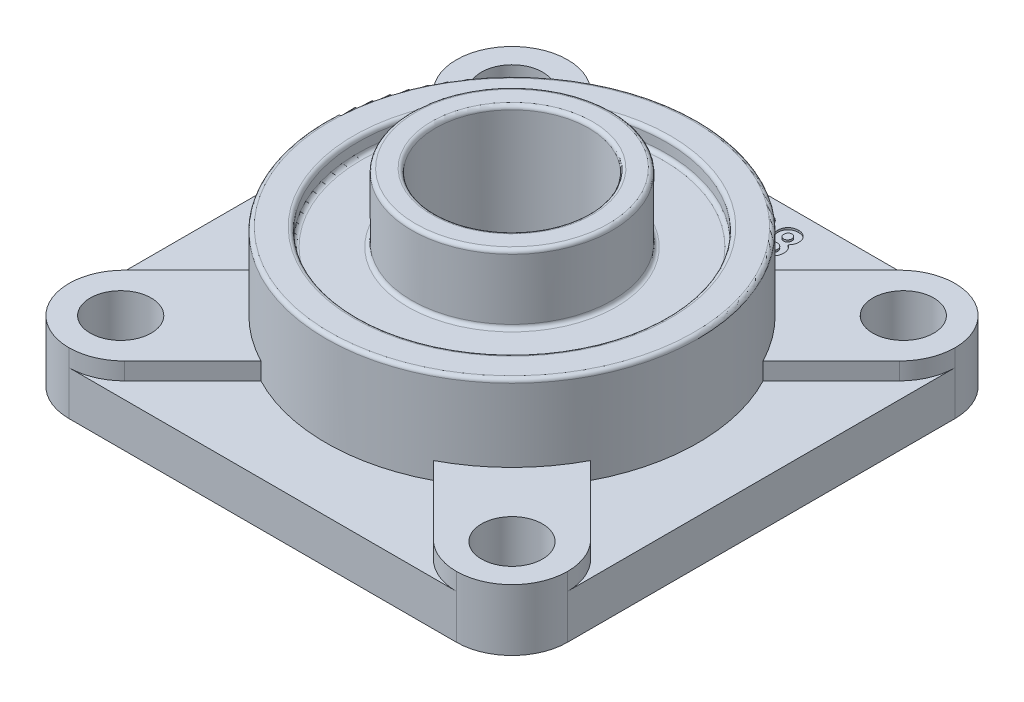
from build123d import *

# Parameters (mm, degrees)
ESBO_O1_W                = 130
ESBO_O1_H                = 130
RESSALTO_EXTRUS_O1_DEPTH = 11.5
RESSALTO_EXTRUS_O2_DEPTH = 4.5
ESBO_O3_R                = 48.5
RESSALTO_EXTRUS_O3_DEPTH = 36
ESBO_O5_R                = 26.15
RESSALTO_EXTRUS_O4_DEPTH = 49.3
CORTE_EXTRUS_O1_START    = -4.5
ESBO_O6_R                = 40.25
ESBO_O6_R_2              = 26.15
CORTE_EXTRUS_O1_DEPTH    = 4.5
ESBO_O7_R                = 20
CORTE_EXTRUS_O2_DEPTH    = 105.309587287
CORTE_EXTRUS_O3_DEPTH    = 98.769576045
FILETE4_R                = 14.5
FILETE5_R                = 1
CORTE_EXTRUS_O4_DEPTH    = 0.5
FILETE6_R                = 1


with BuildPart() as part:
    # Esboço1 → Ressalto-extrusão1 (new body)
    with BuildSketch(Plane(origin=(0, 0, 0), x_dir=(1, 0, 0), z_dir=(0, 1, 0))):
        Rectangle(ESBO_O1_W, ESBO_O1_H)
    extrude(amount=RESSALTO_EXTRUS_O1_DEPTH)

    # Esboço2 → Ressalto-extrusão2 (add)
    with BuildSketch(Plane(origin=(0, 11.5, 0), x_dir=(1, 0, 0), z_dir=(0, 1, 0))):
        Polygon((-10.253048327, 10.253048327), (-65, 65), (-65, 44.493903346), (-20.506096654, 0), align=None)
        Polygon((-44.493903346, 65), (-65, 65), (-10.253048327, 10.253048327), (0, 20.506096654), align=None)
        Polygon((44.493903346, 65), (0, 20.506096654), (10.253048327, 10.253048327), (65, 65), align=None)
        Polygon((65, 65), (10.253048327, 10.253048327), (20.506096654, 0), (65, 44.493903346), align=None)
        Polygon((0, 0), (-10.253048327, 10.253048327), (-20.506096654, 0), (-10.253048327, -10.253048327), align=None)
        Polygon((0, 20.506096654), (-10.253048327, 10.253048327), (0, 0), (10.253048327, 10.253048327), align=None)
        Polygon((10.253048327, 10.253048327), (0, 0), (10.253048327, -10.253048327), (20.506096654, 0), align=None)
        Polygon((10.253048327, -10.253048327), (0, 0), (-10.253048327, -10.253048327), (0, -20.506096654), align=None)
        Polygon((-10.253048327, -10.253048327), (-20.506096654, 0), (-65, -44.493903346), (-65, -65), align=None)
        Polygon((0, -20.506096654), (-10.253048327, -10.253048327), (-65, -65), (-44.493903346, -65), align=None)
        Polygon((65, -65), (10.253048327, -10.253048327), (0, -20.506096654), (44.493903346, -65), align=None)
        Polygon((20.506096654, 0), (10.253048327, -10.253048327), (65, -65), (65, -44.493903346), align=None)
    extrude(amount=RESSALTO_EXTRUS_O2_DEPTH)

    # Esboço3 → Ressalto-extrusão3 (add)
    with BuildSketch(Plane.XZ):
        with Locations(Location((0, 0, 0), (0, 0, 270))):
            Circle(ESBO_O3_R)
    extrude(amount=-RESSALTO_EXTRUS_O3_DEPTH)

    # Esboço5 → Ressalto-extrusão4 (add)
    with BuildSketch(Plane.XZ):
        with Locations(Location((0, 0, 0), (0, 0, 270))):
            Circle(ESBO_O5_R)
    extrude(amount=-RESSALTO_EXTRUS_O4_DEPTH)

    # Esboço6 → Corte-extrusão1 (cut)
    with BuildSketch(Plane(origin=(0, 36, 0), x_dir=(1, 0, 0), z_dir=(0, 1, 0)).offset(CORTE_EXTRUS_O1_START)):
        with Locations(Location((0, 0, 0), (0, 0, 270))):
            Circle(ESBO_O6_R)
        with Locations(Location((0, 0, 0), (0, 0, 90))):
            Circle(ESBO_O6_R_2, mode=Mode.SUBTRACT)
    extrude(amount=CORTE_EXTRUS_O1_DEPTH, mode=Mode.SUBTRACT)

    # Esboço7 → Corte-extrusão2 (cut, through all)
    with BuildSketch(Plane(origin=(0, 49.3, 0), x_dir=(1, 0, 0), z_dir=(0, 1, 0))):
        with Locations(Location((0, 0, 0), (0, 0, 270))):
            Circle(ESBO_O7_R)
    extrude(amount=-CORTE_EXTRUS_O2_DEPTH, mode=Mode.SUBTRACT)

    # Esboço8 → Corte-extrusão3 (cut, through all)
    with BuildSketch(Plane(origin=(0, 16, 0), x_dir=(1, 0, 0), z_dir=(0, 1, 0))):
        with BuildLine():
            ThreePointArc((-51, -43.05), (-56.62149891, -56.62149891), (-43.05, -51))
            Line((-43.05, -51), (-51, -51))
            Line((-51, -51), (-51, -43.05))
        make_face()
        with BuildLine():
            Line((-51, -51), (-43.05, -51))
            ThreePointArc((-43.05, -51), (-45.37850109, -45.37850109), (-51, -43.05))
            Line((-51, -43.05), (-51, -51))
        make_face()
        with BuildLine():
            ThreePointArc((-43.05, 51), (-56.62149891, 56.62149891), (-51, 43.05))
            Line((-51, 43.05), (-51, 51))
            Line((-51, 51), (-43.05, 51))
        make_face()
        with BuildLine():
            Line((-51, 51), (-51, 43.05))
            ThreePointArc((-51, 43.05), (-45.37850109, 45.37850109), (-43.05, 51))
            Line((-43.05, 51), (-51, 51))
        make_face()
        with BuildLine():
            ThreePointArc((43.05, 51), (45.37850109, 45.37850109), (51, 43.05))
            Line((51, 43.05), (51, 51))
            Line((51, 51), (43.05, 51))
        make_face()
        with BuildLine():
            Line((51, 51), (51, 43.05))
            ThreePointArc((51, 43.05), (56.62149891, 45.37850109), (58.95, 51))
            ThreePointArc((58.95, 51), (51, 58.95), (43.05, 51))
            Line((43.05, 51), (51, 51))
        make_face()
        with BuildLine():
            ThreePointArc((51, -43.05), (45.37850109, -45.37850109), (43.05, -51))
            Line((43.05, -51), (51, -51))
            Line((51, -51), (51, -43.05))
        make_face()
        with BuildLine():
            Line((51, -51), (43.05, -51))
            ThreePointArc((43.05, -51), (51, -58.95), (58.95, -51))
            ThreePointArc((58.95, -51), (56.62149891, -45.37850109), (51, -43.05))
            Line((51, -43.05), (51, -51))
        make_face()
    extrude(amount=-CORTE_EXTRUS_O3_DEPTH, mode=Mode.SUBTRACT)

    # Filete4
    # the kernel refuses this fillet: 14.5 mm, written as the material it adds along each edge
    # the kernel refuses this fillet: 14.5 mm, written as the material it takes off along each edge
    with BuildSketch(Plane(origin=(-65, 11.5, -44.493903346), x_dir=(0, 0, -1), z_dir=(0, 1, 0)), Plane(origin=(65, 11.5, 44.493903346), x_dir=(0, 0, 1), z_dir=(0, 1, 0)), Plane(origin=(44.493903346, 11.5, -65), x_dir=(1, 0, 0), z_dir=(0, 1, 0)), Plane(origin=(-44.493903346, 11.5, 65), x_dir=(-1, 0, 0), z_dir=(0, 1, 0))) as filete4_2_piece_1:
        with BuildLine():
            CenterArc((FILETE4_R * 0.414213562373, -FILETE4_R), FILETE4_R, 90, 45)
            Line((-FILETE4_R * 0.292893218813, -FILETE4_R * 0.292893218813), (0, 0))
            Line((0, 0), (FILETE4_R * 0.414213562373, 0))
        make_face()
    extrude(amount=19.515241636, mode=Mode.SUBTRACT)
    with BuildSketch(Plane(origin=(44.493903346, 11.5, 65), x_dir=(1, 0, 0), z_dir=(0, 1, 0)), Plane(origin=(-44.493903346, 11.5, -65), x_dir=(-1, 0, 0), z_dir=(0, 1, 0)), Plane(origin=(-65, 11.5, 44.493903346), x_dir=(0, 0, 1), z_dir=(0, 1, 0)), Plane(origin=(65, 11.5, -44.493903346), x_dir=(0, 0, -1), z_dir=(0, 1, 0))) as filete4_2_piece_2:
        with BuildLine():
            CenterArc((FILETE4_R * 0.414213562373, FILETE4_R), FILETE4_R, 225, 45)
            Line((-FILETE4_R * 0.292893218813, FILETE4_R * 0.292893218813), (0, 0))
            Line((0, 0), (FILETE4_R * 0.414213562373, 0))
        make_face()
    extrude(amount=19.515241636, mode=Mode.SUBTRACT)
    with BuildSketch(Plane(origin=(-65, -36.25, -65), x_dir=(1, 0, 0), z_dir=(0, 1, 0)), Plane(origin=(-65, -36.25, 65), x_dir=(0, 0, -1), z_dir=(0, 1, 0)), Plane(origin=(65, 52.25, 65), x_dir=(0, 0, -1), z_dir=(0, -1, 0)), Plane(origin=(65, 52.25, -65), x_dir=(-1, 0, 0), z_dir=(0, -1, 0))) as filete4_2_piece_3:
        with BuildLine():
            CenterArc((FILETE4_R, -FILETE4_R), FILETE4_R, 90, 90)
            Line((0, -FILETE4_R), (0, 0))
            Line((0, 0), (FILETE4_R, 0))
        make_face()
    extrude(amount=88.5, mode=Mode.SUBTRACT)

    # Filete5
    filete5_edges = [part.edges().sort_by_distance(p)[0] for p in [
        (0, 49.3, 26.15),
        (0, 36, -40.25),
        (0, 49.3, -20),
        (0, 36, 48.5),
    ]]
    fillet(filete5_edges, radius=FILETE5_R)

    # Esboço9 → Corte-extrusão4 (cut)
    # profile 1 of 4: a face of its own
    with BuildSketch(Plane(origin=(0, 11.5, 0), x_dir=(1, 0, 0), z_dir=(0, 1, 0))):
        Polygon((-13.5673169, 60.857243767), (-8.926932285, 60.857243767), (-8.926932285, 59.147628382), (-11.857701516, 59.147628382), (-11.857701516, 57.315897613), (-8.926932285, 57.315897613), (-8.926932285, 55.606282228), (-11.857701516, 55.606282228), (-11.857701516, 51.332243767), (-13.5673169, 51.332243767), align=None)
    # profile 2 of 4: a face of its own
    with BuildSketch(Plane(origin=(0, 11.5, 0), x_dir=(1, 0, 0), z_dir=(0, 1, 0))):
        with BuildLine():
            Line((-2.4548169, 57.682243767), (-4.164432285, 57.682243767))
            add(Edge.make_bspline(
                [(-4.164432285, 57.682243767), (-4.157048718, 57.811567126), (-4.142621672, 58.064257205), (-4.08523453, 58.431297637), (-4.008337729, 58.778110483), (-3.90570874, 59.103482555), (-3.776748699, 59.407295624), (-3.624776082, 59.690585403), (-3.445908333, 59.951860367), (-3.243952346, 60.1898605), (-3.022336778, 60.403372615), (-2.785662586, 60.59268587), (-2.530309519, 60.748902404), (-2.260943087, 60.877454148), (-1.977609157, 60.980161018), (-1.677626945, 61.048828872), (-1.36359386, 61.095331416), (-1.148612783, 61.099400575), (-1.03904166, 61.101474536)],
                knots=[0, 0, 0, 0, 1.199038563, 2.342849363, 3.436047546, 4.486744587, 5.497670872, 6.488682221, 7.459191391, 8.424610317, 9.374430501, 10.305433194, 11.225809216, 12.140057399, 13.06607119, 14.010487599, 14.985989317, 16, 16, 16, 16], degree=3))
            add(Edge.make_bspline(
                [(-1.03904166, 61.101474536), (-0.904544661, 61.097277875), (-0.641974999, 61.089085009), (-0.260440454, 61.019197146), (0.095871095, 60.902298896), (0.426700644, 60.738961211), (0.729231782, 60.531457804), (1.003414341, 60.284043952), (1.240956603, 59.991528782), (1.443364657, 59.666083373), (1.611541559, 59.321482487), (1.729392927, 58.965150882), (1.806855362, 58.606544152), (1.81511721, 58.365076531), (1.819221561, 58.245119368)],
                knots=[0, 0, 0, 0, 1.075374347, 2.099382735, 3.09057751, 4.06680945, 5.040638231, 6.016817125, 7.011024321, 8.044445721, 9.0776792, 10.070479129, 11.0414456, 12, 12, 12, 12], degree=3))
            add(Edge.make_bspline(
                [(1.819221561, 58.245119368), (1.817623544, 58.172560797), (1.814407129, 58.026518317), (1.792042971, 57.805520201), (1.758492315, 57.580407783), (1.707906103, 57.351374074), (1.644820948, 57.118354873), (1.568289538, 56.880652833), (1.47653665, 56.639615639), (1.371093454, 56.392530458), (1.245299454, 56.138595101), (1.098829826, 55.874002977), (0.927796934, 55.598988802), (0.734266641, 55.311999755), (0.517299016, 55.013488463), (0.275834894, 54.704354135), (0.012655376, 54.38350748), (-0.174130532, 54.169039496), (-0.270096347, 54.058851339)],
                knots=[0, 0, 0, 0, 0.728284026, 1.46585585, 2.227944881, 3.01186502, 3.81876927, 4.650621989, 5.517437689, 6.406905708, 7.346299482, 8.360816762, 9.441613733, 10.596154504, 11.834900912, 13.145207542, 14.533280747, 16, 16, 16, 16], degree=3))
            Line((-0.270096347, 54.058851339), (-1.2641919, 52.919743767))
            Line((-1.2641919, 52.919743767), (1.941336946, 52.919743767))
            Line((1.941336946, 52.919743767), (1.941336946, 51.332243767))
            Line((1.941336946, 51.332243767), (-4.408663054, 51.332243767))
            Line((-4.408663054, 51.332243767), (-4.408663054, 52.198499776))
            Line((-4.408663054, 52.198499776), (-1.588560891, 55.199866964))
            add(Edge.make_bspline(
                [(-1.588560891, 55.199866964), (-1.506911686, 55.287417777), (-1.34878139, 55.456977738), (-1.123778275, 55.705994579), (-0.920170332, 55.942305618), (-0.742179536, 56.16842709), (-0.580465161, 56.377024534), (-0.442238037, 56.574385338), (-0.326233494, 56.758725289), (-0.20029411, 56.981007076), (-0.080693094, 57.246117662), (0.029048077, 57.551535926), (0.095942915, 57.843445448), (0.105176518, 58.033659967), (0.109606177, 58.124912036)],
                knots=[0, 0, 0, 0, 1.246127091, 2.413378631, 3.493388633, 4.492180848, 5.408488754, 6.240484944, 6.999099869, 7.674939598, 8.898438119, 10.020720584, 11.050475521, 12, 12, 12, 12], degree=3))
            add(Edge.make_bspline(
                [(0.109606177, 58.124912036), (0.106294228, 58.213191373), (0.099876796, 58.384246741), (0.029354422, 58.627572093), (-0.079901286, 58.847878359), (-0.233858009, 59.038582541), (-0.420347819, 59.195296813), (-0.635854312, 59.311856485), (-0.878620477, 59.379110882), (-1.048804183, 59.38752873), (-1.136352357, 59.391859151)],
                knots=[0, 0, 0, 0, 1.062038974, 2.057870785, 3.028805853, 4.01125022, 4.991535629, 5.949134679, 6.94496649, 8, 8, 8, 8], degree=3))
            add(Edge.make_bspline(
                [(-1.136352357, 59.391859151), (-1.181580859, 59.390259442), (-1.270620428, 59.387110156), (-1.401501635, 59.366146216), (-1.526044506, 59.32919946), (-1.645635274, 59.279696008), (-1.758997633, 59.214078826), (-1.865845649, 59.133195195), (-1.967305099, 59.039100552), (-2.062910651, 58.932089118), (-2.149924184, 58.812664327), (-2.227209286, 58.681916879), (-2.291111199, 58.539927934), (-2.347372766, 58.388571962), (-2.390764378, 58.226223276), (-2.422358855, 58.053853516), (-2.446378026, 57.871743105), (-2.451952769, 57.746559322), (-2.4548169, 57.682243767)],
                knots=[0, 0, 0, 0, 0.903469896, 1.778625579, 2.63899355, 3.493148037, 4.358286772, 5.247621495, 6.164656832, 7.118446693, 8.109501108, 9.111810964, 10.146451449, 11.215617525, 12.33435995, 13.498009769, 14.714554818, 16, 16, 16, 16], degree=3))
        make_face()
    # profile 3 of 4: a face of its own
    with BuildSketch(Plane(origin=(0, 11.5, 0), x_dir=(1, 0, 0), z_dir=(0, 1, 0))):
        with BuildLine():
            add(Edge.make_bspline(
                [(6.247812306, 61.101474536), (6.330564787, 61.100246052), (6.493278273, 61.097830524), (6.73292461, 61.071668393), (6.96377029, 61.03214471), (7.186718411, 60.977022953), (7.40016417, 60.904071272), (7.605661068, 60.81674936), (7.800763098, 60.710477003), (7.987958434, 60.590436918), (8.167174969, 60.454534524), (8.334105358, 60.299598778), (8.491798105, 60.129194758), (8.636839742, 59.940746261), (8.772442262, 59.735967426), (8.898160096, 59.51482578), (9.013030844, 59.276238985), (9.118341933, 59.01977649), (9.212511441, 58.741594035), (9.291830301, 58.438500745), (9.359859496, 58.110427405), (9.417280936, 57.756557389), (9.460682264, 57.37642032), (9.489935633, 56.970268742), (9.51001068, 56.538885656), (9.511649065, 56.242960404), (9.512490792, 56.090927661)],
                knots=[0, 0, 0, 0, 0.879237366, 1.728815576, 2.559023295, 3.367336655, 4.166867292, 4.954216142, 5.737608147, 6.525189134, 7.316157332, 8.124696809, 8.942788509, 9.781158001, 10.649253743, 11.551476218, 12.482711956, 13.461909668, 14.496590415, 15.601789533, 16.789733467, 18.056700938, 19.410929216, 20.8549011, 22.384193279, 24, 24, 24, 24], degree=3))
            add(Edge.make_bspline(
                [(9.512490792, 56.090927661), (9.511581113, 55.936992818), (9.509813622, 55.637900178), (9.490770159, 55.202571443), (9.457976415, 54.793470961), (9.415709472, 54.410641057), (9.357815321, 54.054283896), (9.290013222, 53.723476753), (9.209442338, 53.418339537), (9.112170916, 53.139559788), (9.007497278, 52.882646889), (8.892312309, 52.644525281), (8.768623667, 52.424549999), (8.639268398, 52.219402416), (8.497154768, 52.035130178), (8.349199849, 51.865467067), (8.188961421, 51.716875767), (8.023186139, 51.58169855), (7.845800985, 51.464878308), (7.658635286, 51.36270925), (7.458352201, 51.279838009), (7.248602552, 51.20776103), (7.025811113, 51.156017536), (6.793518008, 51.114960774), (6.549100696, 51.092270289), (6.382691546, 51.089455385), (6.297421681, 51.088012997)],
                knots=[0, 0, 0, 0, 1.643780988, 3.193836972, 4.651895693, 6.025988579, 7.305620092, 8.505800249, 9.631074763, 10.672816429, 11.65661981, 12.592235626, 13.49536222, 14.350718032, 15.179365177, 15.97804903, 16.751647189, 17.51006938, 18.259804725, 19.016521909, 19.783502495, 20.571750527, 21.382245291, 22.22305063, 23.089471752, 24, 24, 24, 24], degree=3))
            add(Edge.make_bspline(
                [(6.297421681, 51.088012997), (6.212154118, 51.089483208), (6.045116216, 51.092363328), (5.800037976, 51.11479206), (5.566513835, 51.156183857), (5.341959757, 51.208158278), (5.127938603, 51.279678531), (4.923424149, 51.36502922), (4.729988933, 51.466560794), (4.547097364, 51.583653217), (4.375373886, 51.717925996), (4.212149917, 51.867942933), (4.057786518, 52.033323774), (3.914631939, 52.21592092), (3.780341721, 52.413297082), (3.656316301, 52.627706198), (3.542630213, 52.858836095), (3.435727336, 53.107008942), (3.342842268, 53.377567618), (3.26017887, 53.672928177), (3.192463189, 53.995552693), (3.138001707, 54.345337519), (3.094519691, 54.72154162), (3.062174069, 55.124346581), (3.043024828, 55.553940016), (3.041275873, 55.849220984), (3.040375407, 56.001249175)],
                knots=[0, 0, 0, 0, 0.917216111, 1.796812873, 2.643793957, 3.46689424, 4.273913431, 5.068098542, 5.848489301, 6.620921603, 7.401012384, 8.190319798, 9.003608147, 9.831726257, 10.68377682, 11.569763213, 12.493818149, 13.453288342, 14.474581811, 15.568529029, 16.750744269, 18.018426408, 19.375425659, 20.823733699, 22.36466933, 24, 24, 24, 24], degree=3))
            add(Edge.make_bspline(
                [(3.040375407, 56.001249175), (3.042006517, 56.212480379), (3.045153764, 56.620053709), (3.085037988, 57.208878668), (3.143577913, 57.753145343), (3.229559195, 58.251943311), (3.335873863, 58.707119973), (3.47201533, 59.115676864), (3.627002486, 59.483267284), (3.759071455, 59.701030063), (3.82267709, 59.805906627)],
                knots=[0, 0, 0, 0, 1.288568992, 2.486310467, 3.599230591, 4.627010532, 5.572937695, 6.447898582, 7.252493626, 8, 8, 8, 8], degree=3))
            add(Edge.make_bspline(
                [(3.82267709, 59.805906627), (3.896634693, 59.908937332), (4.041236379, 60.110382661), (4.294076469, 60.374842723), (4.565720227, 60.601021918), (4.86174706, 60.783801608), (5.177475181, 60.927941687), (5.515615275, 61.029746201), (5.87491865, 61.089062255), (6.12165827, 61.097275324), (6.247812306, 61.101474536)],
                knots=[0, 0, 0, 0, 1.058512271, 2.069600068, 3.047294572, 4.004278952, 4.967380941, 5.939006123, 6.946246673, 8, 8, 8, 8], degree=3))
        make_face()
        with BuildLine():
            add(Edge.make_bspline(
                [(6.28978947, 59.391859151), (6.214980541, 59.388313357), (6.068315331, 59.381361717), (5.855497122, 59.322352107), (5.654822838, 59.231208581), (5.502175271, 59.121531599), (5.387920085, 59.016393058), (5.308089167, 58.921246099), (5.231104829, 58.815068949), (5.163108385, 58.69307038), (5.098901992, 58.559633945), (5.036152993, 58.414153923), (4.984715291, 58.253057009), (4.934179112, 58.079086704), (4.889904704, 57.887433192), (4.852812456, 57.676529917), (4.819673793, 57.445005355), (4.79655918, 57.192707858), (4.775009425, 56.91990139), (4.75956154, 56.625978246), (4.753103166, 56.311017719), (4.751050246, 56.094109078), (4.749990792, 55.982168646)],
                knots=[0, 0, 0, 0, 1.076674018, 2.110852608, 3.161083442, 4.239746716, 4.804137807, 5.395870207, 6.026861976, 6.692161227, 7.405688833, 8.16177676, 8.973626916, 9.841385931, 10.773283133, 11.807421078, 12.927755683, 14.143907515, 15.458935494, 16.872852025, 18.386167141, 20, 20, 20, 20], degree=3))
            add(Edge.make_bspline(
                [(4.749990792, 55.982168646), (4.751734525, 55.837144406), (4.755078263, 55.559049674), (4.772591197, 55.159139765), (4.807694422, 54.795189546), (4.851355746, 54.464732392), (4.912679857, 54.169911406), (4.983237218, 53.907937308), (5.070369284, 53.682149631), (5.171067176, 53.489282978), (5.282594628, 53.325211717), (5.403662584, 53.185750406), (5.530149112, 53.064983491), (5.66600227, 52.966886014), (5.810897952, 52.891708629), (5.963626545, 52.837634465), (6.124285107, 52.804533417), (6.234302434, 52.799943366), (6.28978947, 52.797628382)],
                knots=[0, 0, 0, 0, 1.771748488, 3.397459088, 4.888034009, 6.237357457, 7.467047327, 8.564189669, 9.548206622, 10.417051504, 11.216568818, 11.965764335, 12.669334354, 13.348544111, 14.005342236, 14.656555988, 15.322436492, 16, 16, 16, 16], degree=3))
            add(Edge.make_bspline(
                [(6.28978947, 52.797628382), (6.343372366, 52.799212466), (6.448281015, 52.802313905), (6.601261321, 52.834149764), (6.745930368, 52.885907955), (6.881851355, 52.959123551), (7.009510454, 53.052228382), (7.128283745, 53.165631593), (7.237275464, 53.300463548), (7.300774534, 53.400528799), (7.333494398, 53.452090521)],
                knots=[0, 0, 0, 0, 0.992283464, 1.942767638, 2.88273346, 3.832339453, 4.79467288, 5.803907806, 6.868395428, 8, 8, 8, 8], degree=3))
            add(Edge.make_bspline(
                [(7.333494398, 53.452090521), (7.372016527, 53.522547967), (7.452794308, 53.670291517), (7.546270496, 53.919603248), (7.624953541, 54.200785676), (7.692674887, 54.514713865), (7.738992157, 54.862625989), (7.778880533, 55.242315906), (7.798119688, 55.655695581), (7.801249041, 55.942086511), (7.802875407, 56.090927661)],
                knots=[0, 0, 0, 0, 0.710965849, 1.490837728, 2.352621235, 3.297892224, 4.334225155, 5.461620853, 6.680770821, 8, 8, 8, 8], degree=3))
            add(Edge.make_bspline(
                [(7.802875407, 56.090927661), (7.802247177, 56.241060824), (7.801037941, 56.530041534), (7.778851966, 56.944907337), (7.7479563, 57.323818396), (7.70276486, 57.665928755), (7.644617858, 57.972068909), (7.572951458, 58.242218845), (7.488462105, 58.476910977), (7.3882678, 58.675911284), (7.277296382, 58.845034246), (7.159496835, 58.990128629), (7.034371054, 59.114006553), (6.902128289, 59.217134192), (6.759707736, 59.295931443), (6.609829813, 59.35156882), (6.452187258, 59.385227568), (6.344652719, 59.389618787), (6.28978947, 59.391859151)],
                knots=[0, 0, 0, 0, 1.793836731, 3.452829483, 4.963243077, 6.335886805, 7.574563692, 8.684454726, 9.672768357, 10.54971625, 11.340229787, 12.085688095, 12.778991901, 13.440269426, 14.083255152, 14.715733572, 15.344777694, 16, 16, 16, 16], degree=3))
        make_face(mode=Mode.SUBTRACT)
    # profile 4 of 4: a face of its own
    with BuildSketch(Plane(origin=(0, 11.5, 0), x_dir=(1, 0, 0), z_dir=(0, 1, 0))):
        with BuildLine():
            add(Edge.make_bspline(
                [(15.534305696, 56.46108992), (15.634187318, 56.389721803), (15.831893977, 56.248455053), (16.092992154, 55.995370389), (16.317888711, 55.71305151), (16.50422199, 55.403230106), (16.653506591, 55.073521665), (16.760371717, 54.727450377), (16.828251217, 54.368068677), (16.835665685, 54.123391592), (16.839413869, 53.999701699)],
                knots=[0, 0, 0, 0, 1.013736912, 2.006600758, 2.994453809, 3.989973287, 4.987781207, 5.978959008, 6.978317308, 8, 8, 8, 8], degree=3))
            add(Edge.make_bspline(
                [(16.839413869, 53.999701699), (16.83489197, 53.865767317), (16.825923365, 53.600125659), (16.746628906, 53.21056221), (16.619324835, 52.836304085), (16.445338977, 52.481482149), (16.227192712, 52.157122908), (15.972922951, 51.869972544), (15.682209167, 51.627530483), (15.4115464, 51.463035109), (15.178577501, 51.353763942), (14.990573644, 51.283832588), (14.792053929, 51.222267817), (14.581601746, 51.17308165), (14.359255367, 51.134683773), (14.125332102, 51.109325888), (13.879677969, 51.090892251), (13.712152237, 51.088988931), (13.626252811, 51.088012997)],
                knots=[0, 0, 0, 0, 1.313679292, 2.605514271, 3.884962679, 5.186178731, 6.472827995, 7.711026938, 8.938935107, 10.174644318, 10.808706728, 11.462743532, 12.142127587, 12.847854939, 13.582806024, 14.355735269, 15.156897313, 16, 16, 16, 16], degree=3))
            add(Edge.make_bspline(
                [(13.626252811, 51.088012997), (13.534649595, 51.089255556), (13.355766577, 51.091682027), (13.094637217, 51.106353754), (12.848315086, 51.13340273), (12.616283484, 51.169010612), (12.398765648, 51.21613016), (12.195755136, 51.275875167), (12.006761757, 51.343901504), (11.775423934, 51.44747744), (11.511046754, 51.609233445), (11.225302832, 51.84612045), (10.974492775, 52.128260274), (10.756437185, 52.447733296), (10.584557548, 52.802574115), (10.456742729, 53.181645435), (10.381049279, 53.58392002), (10.371936634, 53.859458333), (10.367298484, 53.999701699)],
                knots=[0, 0, 0, 0, 0.886964665, 1.7320671, 2.531131818, 3.285397207, 4.004107883, 4.684213108, 5.332925796, 5.947568694, 7.135706876, 8.320776993, 9.52873045, 10.778999824, 12.05415135, 13.333578234, 14.642845846, 16, 16, 16, 16], degree=3))
            add(Edge.make_bspline(
                [(10.367298484, 53.999701699), (10.371536976, 54.122040966), (10.379866125, 54.362452437), (10.439528949, 54.714731276), (10.541832561, 55.048733298), (10.682209039, 55.366783689), (10.863222125, 55.668917838), (11.085942224, 55.952912632), (11.34754547, 56.2213301), (11.5459241, 56.379844329), (11.64760197, 56.46108992)],
                knots=[0, 0, 0, 0, 1.01821053, 2.000906977, 2.963938143, 3.919209931, 4.888045165, 5.887808425, 6.917407893, 8, 8, 8, 8], degree=3))
            add(Edge.make_bspline(
                [(11.64760197, 56.46108992), (11.584567084, 56.533791439), (11.460470377, 56.676918834), (11.299888019, 56.90727097), (11.164604143, 57.144764263), (11.049741692, 57.387471331), (10.964832439, 57.639570983), (10.900621471, 57.897099698), (10.864303809, 58.162681102), (10.858627249, 58.34169086), (10.855760023, 58.43210855)],
                knots=[0, 0, 0, 0, 1.061529281, 2.089831458, 3.092927091, 4.075998741, 5.048384512, 6.024008542, 7.00192825, 8, 8, 8, 8], degree=3))
            add(Edge.make_bspline(
                [(10.855760023, 58.43210855), (10.859561528, 58.554507447), (10.867061753, 58.795995755), (10.933490803, 59.149108678), (11.043779157, 59.484636333), (11.193817077, 59.801596346), (11.384341917, 60.093080912), (11.610726674, 60.354477409), (11.876153874, 60.576210983), (12.170752992, 60.766468177), (12.496000698, 60.917796984), (12.848811074, 61.02368555), (13.224923884, 61.090718595), (13.484129606, 61.09783468), (13.616712547, 61.101474536)],
                knots=[0, 0, 0, 0, 1.022455555, 2.017265428, 2.990720743, 3.968117071, 4.939886797, 5.893155559, 6.847550415, 7.820889576, 8.817530429, 9.83499769, 10.892607882, 12, 12, 12, 12], degree=3))
            add(Edge.make_bspline(
                [(13.616712547, 61.101474536), (13.747385947, 61.097828723), (14.002171716, 61.090720152), (14.371674847, 61.024131269), (14.716860923, 60.915884015), (15.034875508, 60.761359981), (15.326427897, 60.570736088), (15.58734396, 60.341281958), (15.813018316, 60.073374958), (16.005124633, 59.774349771), (16.158203848, 59.452193458), (16.27137477, 59.114345683), (16.336834169, 58.763461963), (16.346227458, 58.525228473), (16.35095233, 58.40539581)],
                knots=[0, 0, 0, 0, 1.094655142, 2.134348324, 3.136019022, 4.118575226, 5.088726318, 6.048298823, 7.020513804, 8.015920439, 9.020015034, 10.003048569, 10.995523219, 12, 12, 12, 12], degree=3))
            add(Edge.make_bspline(
                [(16.35095233, 58.40539581), (16.348676246, 58.320704564), (16.3442096, 58.154504325), (16.31118412, 57.909644469), (16.255573266, 57.674701107), (16.178039143, 57.443996626), (16.070240245, 57.211261499), (15.924363273, 56.972036097), (15.746923091, 56.716380559), (15.607570451, 56.549059233), (15.534305696, 56.46108992)],
                knots=[0, 0, 0, 0, 0.940746401, 1.846144481, 2.739104268, 3.619506754, 4.545839139, 5.581956076, 6.728711598, 8, 8, 8, 8], degree=3))
        make_face()
        with BuildLine():
            add(Edge.make_bspline(
                [(13.574735383, 59.391859151), (13.504346948, 59.388465777), (13.367425889, 59.381864915), (13.172055572, 59.322284824), (12.996411281, 59.224837348), (12.844502447, 59.090730442), (12.719929283, 58.928011803), (12.628374853, 58.740933476), (12.574081993, 58.531804218), (12.568334038, 58.385367947), (12.565375407, 58.309993166)],
                knots=[0, 0, 0, 0, 1.018099191, 1.980427864, 2.929421084, 3.909248076, 4.895556904, 5.880788387, 6.909183412, 8, 8, 8, 8], degree=3))
            add(Edge.make_bspline(
                [(12.565375407, 58.309993166), (12.569030221, 58.233974668), (12.576166596, 58.085541224), (12.632286175, 57.872393913), (12.727943548, 57.679221834), (12.859280474, 57.510059717), (13.018876107, 57.371892993), (13.197574293, 57.266368939), (13.397356825, 57.206127993), (13.536186512, 57.197959106), (13.607172282, 57.193782228)],
                knots=[0, 0, 0, 0, 1.07118507, 2.091592095, 3.082435519, 4.092579768, 5.090825648, 6.043203473, 6.999459622, 8, 8, 8, 8], degree=3))
            add(Edge.make_bspline(
                [(13.607172282, 57.193782228), (13.679500075, 57.197018593), (13.820408186, 57.203323638), (14.020689549, 57.265127668), (14.201117462, 57.363970619), (14.355627311, 57.503712684), (14.483608932, 57.672936063), (14.57681499, 57.869483994), (14.630461031, 58.089663595), (14.637622967, 58.243548923), (14.641336946, 58.323349536)],
                knots=[0, 0, 0, 0, 1.008803858, 1.965339183, 2.900766489, 3.864508618, 4.855158575, 5.849593072, 6.884859315, 8, 8, 8, 8], degree=3))
            add(Edge.make_bspline(
                [(14.641336946, 58.323349536), (14.637529018, 58.398674489), (14.63016462, 58.544350303), (14.577359068, 58.753493128), (14.480379029, 58.937651608), (14.352959769, 59.099359798), (14.193210166, 59.229767395), (14.007752578, 59.325669929), (13.797952637, 59.381294327), (13.650752397, 59.388261282), (13.574735383, 59.391859151)],
                knots=[0, 0, 0, 0, 1.065910571, 2.061433587, 3.023559535, 3.990682701, 4.956464619, 5.918590567, 6.925120432, 8, 8, 8, 8], degree=3))
        make_face(mode=Mode.SUBTRACT)
        with BuildLine():
            add(Edge.make_bspline(
                [(13.630068917, 55.484166844), (13.576579034, 55.483278564), (13.471151143, 55.481527777), (13.31616348, 55.461338575), (13.16743689, 55.431251671), (13.02515589, 55.389747635), (12.890039277, 55.33316719), (12.76094171, 55.264958419), (12.638309034, 55.184431815), (12.523960234, 55.093049341), (12.420615639, 54.992748369), (12.327459888, 54.888137707), (12.251318213, 54.776512886), (12.187910352, 54.661584349), (12.136961776, 54.542441352), (12.103280917, 54.417121854), (12.081595159, 54.287294759), (12.078483479, 54.198861807), (12.076913869, 54.154253983)],
                knots=[0, 0, 0, 0, 1.129580664, 2.226389355, 3.296443603, 4.333934503, 5.352185725, 6.386189251, 7.41493955, 8.447544828, 9.47401038, 10.455044306, 11.4018853, 12.322125673, 13.225630306, 14.132028716, 15.057747923, 16, 16, 16, 16], degree=3))
            add(Edge.make_bspline(
                [(12.076913869, 54.154253983), (12.077661973, 54.107732427), (12.079145744, 54.015462679), (12.101556036, 53.880787527), (12.133822896, 53.750902592), (12.179142734, 53.627023675), (12.239749405, 53.509222898), (12.312114871, 53.396354984), (12.398762486, 53.28921138), (12.497342828, 53.188366552), (12.607703083, 53.097386517), (12.726647252, 53.01723152), (12.852604355, 52.946562773), (12.989355534, 52.895664341), (13.131836348, 52.849077625), (13.283863901, 52.820814586), (13.443777715, 52.800017857), (13.553035122, 52.798438524), (13.609080335, 52.797628382)],
                knots=[0, 0, 0, 0, 0.973817353, 1.931446211, 2.852767904, 3.776304432, 4.688323523, 5.623710549, 6.581246645, 7.570897993, 8.57436511, 9.572506873, 10.574556662, 11.591826551, 12.624694332, 13.712108235, 14.826391851, 16, 16, 16, 16], degree=3))
            add(Edge.make_bspline(
                [(13.609080335, 52.797628382), (13.665733709, 52.798655292), (13.776133191, 52.800656413), (13.937515035, 52.818342538), (14.090153617, 52.846405274), (14.233866618, 52.886541522), (14.369197494, 52.937957656), (14.494330895, 53.003400219), (14.612123824, 53.077564854), (14.718790996, 53.164211329), (14.816185986, 53.2586379), (14.900105444, 53.362121392), (14.971461228, 53.47133415), (15.029017445, 53.587456216), (15.075460143, 53.709939449), (15.107316919, 53.840005137), (15.127085194, 53.976191641), (15.128884344, 54.068958503), (15.129798484, 54.116092925)],
                knots=[0, 0, 0, 0, 1.200705402, 2.339794563, 3.437264955, 4.487414319, 5.499029866, 6.500076882, 7.476298407, 8.444948224, 9.407950986, 10.347155707, 11.263432813, 12.167927724, 13.089546445, 14.03463663, 15.00140776, 16, 16, 16, 16], degree=3))
            add(Edge.make_bspline(
                [(15.129798484, 54.116092925), (15.128053016, 54.163843563), (15.12464123, 54.257179513), (15.105972441, 54.395011994), (15.070951698, 54.525679342), (15.025134336, 54.652212058), (14.964186724, 54.771991762), (14.888521583, 54.884765657), (14.80239608, 54.993327286), (14.701734395, 55.09284388), (14.591676497, 55.183837419), (14.474537405, 55.264902674), (14.350677924, 55.33355747), (14.219759256, 55.389679353), (14.081303055, 55.431273267), (13.936365746, 55.461337518), (13.785185082, 55.481532296), (13.682288615, 55.483279926), (13.630068917, 55.484166844)],
                knots=[0, 0, 0, 0, 1.011708178, 1.977538892, 2.938094892, 3.871441737, 4.823268678, 5.775953079, 6.743660653, 7.753304209, 8.767430709, 9.76505158, 10.765940967, 11.761741361, 12.775867861, 13.822051386, 14.89469657, 16, 16, 16, 16], degree=3))
        make_face(mode=Mode.SUBTRACT)
    extrude(amount=-CORTE_EXTRUS_O4_DEPTH, mode=Mode.SUBTRACT)

    # Filete6
    filete6_edges = [part.edges().sort_by_distance(p)[0] for p in [
        (0, 31.5, -40.25),
        (0, 31.5, 26.15),
    ]]
    fillet(filete6_edges, radius=FILETE6_R)


solid = part.part
